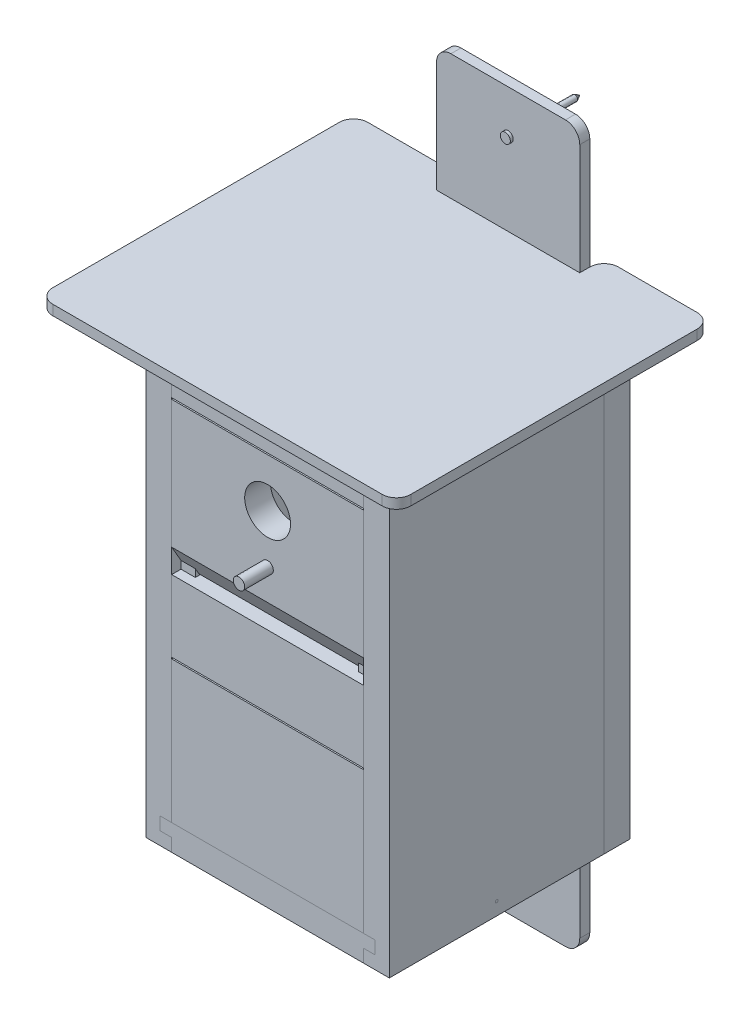
from build123d import *

# Parameters (mm, degrees)
SKIZZE1_W                             = 18
SKIZZE1_H                             = 300
AUFSATZ_LINEAR_AUSTRAGEN1_DEPTH       = 75
AUFSATZ_LINEAR_AUSTRAGEN1_2_DEPTH     = 75
SCHNITT_LINEAR_AUSTRAGEN1_DEPTH       = 321.702354216
SCHNITT_LINEAR_AUSTRAGEN1_DEPTH_BACK  = 321.702354216
SKIZZE2_W                             = 154
SKIZZE2_H                             = 5
SKIZZE3_W                             = 20
SKIZZE3_H                             = 5
AUFSATZ_LINEAR_AUSTRAGEN2_DEPTH       = 300
AUFSATZ_LINEAR_AUSTRAGEN2_2_DEPTH     = 300
AUFSATZ_LINEAR_AUSTRAGEN3_DEPTH       = 300
SKIZZE5_W                             = 170
SKIZZE5_H                             = 18
AUFSATZ_LINEAR_AUSTRAGEN4_DEPTH       = 300
SCHNITT_LINEAR_START                  = -150
SKIZZE6_W                             = 134
SKIZZE6_H                             = 18
SCHNITT_LINEAR_AUSTRAGEN2_DEPTH       = 150
SKIZZE7_W                             = 134
SKIZZE7_H                             = 18
AUFSATZ_LINEAR_AUSTRAGEN5_DEPTH       = 150
SKIZZE8_W                             = 8
SKIZZE8_H                             = 168
AUFSATZ_LINEAR_AUSTRAGEN6_DEPTH       = 8
AUFSATZ_LINEAR_AUSTRAGEN6_2_DEPTH     = 8
AUFSATZ_LINEAR_AUSTRAGEN6_3_DEPTH     = 8
AUFSATZ_LINEAR_AUSTRAGEN6_4_DEPTH     = 8
SKIZZE9_R                             = 1
SCHNITT_LINEAR_AUSTRAGEN3_DEPTH       = 8
SKIZZE10_W                            = 134
SKIZZE10_H                            = 168
AUFSATZ_LINEAR_AUSTRAGEN7_DEPTH       = 8
SKIZZE11_W                            = 170
SKIZZE11_H                            = 168
AUFSATZ_LINEAR_AUSTRAGEN8_DEPTH       = 10
SKIZZE12_W                            = 250
SKIZZE12_H                            = 220
AUFSATZ_LINEAR_AUSTRAGEN9_DEPTH       = 7
SKIZZE13_W                            = 100
SKIZZE13_H                            = 500
AUFSATZ_LINEAR_AUSTRAGEN10_DEPTH      = 7
SKIZZE14_W                            = 100
SKIZZE14_H                            = 500
SCHNITT_LINEAR_AUSTRAGEN4_DEPTH       = 379.14238249
VERRUNDUNG1_R                         = 10
VERRUNDUNG2_R                         = 10
SKIZZE15_R                            = 2
SKIZZE15_R_2                          = 1
SCHNITT_LINEAR_AUSTRAGEN5_DEPTH       = 379.14238249
SKIZZE16_W                            = 8
SKIZZE16_H                            = 9
SCHNITT_LINEAR_AUSTRAGEN6_DEPTH       = 150
SKIZZE18_W                            = 249.007887092
SKIZZE18_H                            = 36.15402976
SCHNITT_LINEAR_AUSTRAGEN7_DEPTH       = 7
SKIZZE19_W                            = 150
SKIZZE19_H                            = 9
AUFSATZ_LINEAR_AUSTRAGEN12_DEPTH      = 150
SKIZZE20_R                            = 16
SCHNITT_LINEAR_AUSTRAGEN8_DEPTH       = 28.5
SKIZZE21_W                            = 134
SKIZZE21_H                            = 1
SCHNITT_LINEAR_AUSTRAGEN10_DEPTH      = 28.5
SKIZZE22_R                            = 4
SCHNITT_LINEAR_AUSTRAGEN11_DEPTH      = 28.5
AUFSATZ_LINEAR_AUSTRAGEN13_DEPTH      = 20
AUFSATZ_LINEAR_AUSTRAGEN13_DEPTH_BACK = 38
SKIZZE23_R                            = 4
SCHNITT_LINEAR_AUSTRAGEN12_DEPTH      = 368.588984377
SCHNITT_LINEAR_AUSTRAGEN12_DEPTH_BACK = 368.588984377
SCHNITT_LINEAR_AUSTRAGEN13_DEPTH      = 378.303142626
SCHNITT_LINEAR_AUSTRAGEN13_DEPTH_BACK = 378.303142626
SKIZZE25_R                            = 1
SKIZZE26_R                            = 2
AUFSATZ_LINEAR_AUSTRAGEN14_DEPTH      = 50
SKIZZE27_R                            = 3.5
AUFSATZ_LINEAR_AUSTRAGEN15_DEPTH      = 2
FASE1_SIZE                            = 2
FASE1_SIZE2                           = 3.464101615
SKIZZE28_R                            = 1.25
AUFSATZ_LINEAR_AUSTRAGEN16_DEPTH      = 24
SKIZZE29_R                            = 3
AUFSATZ_LINEAR_AUSTRAGEN17_DEPTH      = 3
FASE2_SIZE                            = 2.383507185
FASE2_SIZE_2                          = 2
FASE3_SIZE                            = 1.1
FASE3_SIZE2                           = 1.905255888
K_RPER_VERSCHIEBEN_KOPIEREN4_ANGLE    = 90
K_RPER_VERSCHIEBEN_KOPIEREN8_ANGLE    = 88.5
K_RPER_VERSCHIEBEN_KOPIEREN10_ANGLE   = 1.5
K_RPER_VERSCHIEBEN_KOPIEREN13_ANGLE   = 120
K_RPER_VERSCHIEBEN_KOPIEREN13_2_ANGLE = 120
SPIEGELN5_ANGLE                       = 180
SPIEGELN5_2_ANGLE                     = 180
SPIEGELN5_3_ANGLE                     = 120
SPIEGELN5_4_ANGLE                     = 120
SPIEGELN5_5_ANGLE                     = 120
SPIEGELN5_6_ANGLE                     = 120
SPIEGELN5_7_ANGLE                     = 120
SPIEGELN5_8_ANGLE                     = 120
SPIEGELN5_9_ANGLE                     = 120
SPIEGELN5_10_ANGLE                    = 120
SKIZZE30_R                            = 1
SCHNITT_LINEAR_AUSTRAGEN14_DEPTH      = 18


with BuildPart() as part:
    # Skizze1 → Aufsatz-Linear austragen1 (new, symmetric)
    with BuildSketch(Plane.XY):
        with Locations((76, -56.026253401)):
            Rectangle(SKIZZE1_W, SKIZZE1_H)
    extrude(amount=AUFSATZ_LINEAR_AUSTRAGEN1_DEPTH, both=True)


with BuildPart() as body_2:
    # Skizze1 → Aufsatz-Linear austragen1 2 (new, symmetric)
    with BuildSketch(Plane.XY):
        with Locations((-76, -56.026253401)):
            Rectangle(SKIZZE1_W, SKIZZE1_H)
    extrude(amount=AUFSATZ_LINEAR_AUSTRAGEN1_2_DEPTH, both=True)


with BuildPart() as schnitt_linear_austragen1_tool:
    # Skizze2 → Schnitt-Linear austragen1 (new, two sides: drawn at the far end of the back side and taken through both)
    with BuildSketch(Plane(origin=(0, 93.973746599, 0), x_dir=(1, 0, 0), z_dir=(0, 1, 0)).offset(-SCHNITT_LINEAR_AUSTRAGEN1_DEPTH_BACK)):
        with Locations((0, -66)):
            Rectangle(SKIZZE2_W, SKIZZE2_H)
    extrude(amount=SCHNITT_LINEAR_AUSTRAGEN1_DEPTH + SCHNITT_LINEAR_AUSTRAGEN1_DEPTH_BACK)


with BuildPart() as part_1:
    add(part.part)

    # Schnitt-Linear austragen1: cut by schnitt_linear_austragen1_tool
    add(schnitt_linear_austragen1_tool.part, mode=Mode.SUBTRACT)


with BuildPart() as body_2_1:
    add(body_2.part)

    # Schnitt-Linear austragen1: cut by schnitt_linear_austragen1_tool
    add(schnitt_linear_austragen1_tool.part, mode=Mode.SUBTRACT)


with BuildPart() as body_3:
    # Skizze3 → Aufsatz-Linear austragen2 (new body)
    with BuildSketch(Plane(origin=(0, 93.973746599, 0), x_dir=(1, 0, 0), z_dir=(0, 1, 0))):
        with Locations((-67, -66)):
            Rectangle(SKIZZE3_W, SKIZZE3_H)
    extrude(amount=-AUFSATZ_LINEAR_AUSTRAGEN2_DEPTH)


with BuildPart() as body_4:
    # Skizze3 → Aufsatz-Linear austragen2 2 (new body)
    with BuildSketch(Plane(origin=(0, 93.973746599, 0), x_dir=(1, 0, 0), z_dir=(0, 1, 0))):
        with Locations((67, -66)):
            Rectangle(SKIZZE3_W, SKIZZE3_H)
    extrude(amount=-AUFSATZ_LINEAR_AUSTRAGEN2_2_DEPTH)


with BuildPart() as body_5:
    # Skizze4 → Aufsatz-Linear austragen3 (new body)
    with BuildSketch(Plane(origin=(0, 93.973746599, 0), x_dir=(1, 0, 0), z_dir=(0, 1, 0))):
        Polygon((-67, -75), (67, -75), (67, -68.5), (57, -68.5), (57, -63.5), (67, -63.5), (67, -57), (-67, -57), (-67, -63.5), (-57, -63.5), (-57, -68.5), (-67, -68.5), align=None)
    extrude(amount=-AUFSATZ_LINEAR_AUSTRAGEN3_DEPTH)


with BuildPart() as body_6:
    # Skizze5 → Aufsatz-Linear austragen4 (new body)
    with BuildSketch(Plane(origin=(0, 93.973746599, 0), x_dir=(1, 0, 0), z_dir=(0, 1, 0))):
        with Locations((0, 84)):
            Rectangle(SKIZZE5_W, SKIZZE5_H)
    extrude(amount=-AUFSATZ_LINEAR_AUSTRAGEN4_DEPTH)

    # Skizze30 → Schnitt-Linear austragen14 (cut)
    with BuildSketch(Plane(origin=(0, 0, -93), x_dir=(-1, 0, 0), z_dir=(0, 0, -1))):
        with Locations((-76, 73.973746599)):
            Circle(SKIZZE30_R)
        with Locations(Location((76, 73.973746599, 0), (0, 0, 180))):
            Circle(SKIZZE30_R)
        with Locations((0, -197.026253401)):
            Circle(SKIZZE30_R)
    extrude(amount=-SCHNITT_LINEAR_AUSTRAGEN14_DEPTH, mode=Mode.SUBTRACT)


with BuildPart() as schnitt_linear_austragen2_tool:
    # Skizze6 → Schnitt-Linear austragen2 (new body)
    with BuildSketch(Plane.XY.offset(75).offset(SCHNITT_LINEAR_START)):
        with Locations((0, -197.026253401)):
            Rectangle(SKIZZE6_W, SKIZZE6_H)
    extrude(amount=SCHNITT_LINEAR_AUSTRAGEN2_DEPTH)


with BuildPart() as body_3_1:
    add(body_3.part)

    # Schnitt-Linear austragen2: cut by schnitt_linear_austragen2_tool
    add(schnitt_linear_austragen2_tool.part, mode=Mode.SUBTRACT)


with BuildPart() as body_4_1:
    add(body_4.part)

    # Schnitt-Linear austragen2: cut by schnitt_linear_austragen2_tool
    add(schnitt_linear_austragen2_tool.part, mode=Mode.SUBTRACT)


with BuildPart() as body_5_1:
    add(body_5.part)

    # Schnitt-Linear austragen2: cut by schnitt_linear_austragen2_tool
    add(schnitt_linear_austragen2_tool.part, mode=Mode.SUBTRACT)

    # Skizze20 → Schnitt-Linear austragen8 (cut, symmetric)
    with BuildSketch(Plane.XY.offset(75)):
        with Locations((0, 33.973746599)):
            Circle(SKIZZE20_R)
    extrude(amount=SCHNITT_LINEAR_AUSTRAGEN8_DEPTH, both=True, mode=Mode.SUBTRACT)

    # Skizze21 → Schnitt-Linear austragen10 (cut, symmetric)
    with BuildSketch(Plane.XY.offset(75)):
        with Locations((0, 68.473746599)):
            Rectangle(SKIZZE21_W, SKIZZE21_H)
        with Locations((0, -37.526253401)):
            Rectangle(SKIZZE21_W, SKIZZE21_H)
        with Locations((0, -88.526253401)):
            Rectangle(SKIZZE21_W, SKIZZE21_H)
    extrude(amount=SCHNITT_LINEAR_AUSTRAGEN10_DEPTH, both=True, mode=Mode.SUBTRACT)


with BuildPart() as body_7:
    # Skizze7 → Aufsatz-Linear austragen5 (new body)
    with BuildSketch(Plane.XY.offset(-75)):
        with Locations((0, -197.026253401)):
            Rectangle(SKIZZE7_W, SKIZZE7_H)
    extrude(amount=AUFSATZ_LINEAR_AUSTRAGEN5_DEPTH)


with BuildPart() as body_8:
    # Skizze8 → Aufsatz-Linear austragen6 (new body)
    with BuildSketch(Plane(origin=(0, 93.973746599, 0), x_dir=(1, 0, 0), z_dir=(0, 1, 0))):
        with Locations((-81, 9)):
            Rectangle(SKIZZE8_W, SKIZZE8_H)
    extrude(amount=AUFSATZ_LINEAR_AUSTRAGEN6_DEPTH)


with BuildPart() as body_9:
    # Skizze8 → Aufsatz-Linear austragen6 2 (new body)
    with BuildSketch(Plane(origin=(0, 93.973746599, 0), x_dir=(1, 0, 0), z_dir=(0, 1, 0))):
        with Locations((-71, 9)):
            Rectangle(SKIZZE8_W, SKIZZE8_H)
    extrude(amount=AUFSATZ_LINEAR_AUSTRAGEN6_2_DEPTH)


with BuildPart() as body_10:
    # Skizze8 → Aufsatz-Linear austragen6 3 (new body)
    with BuildSketch(Plane(origin=(0, 93.973746599, 0), x_dir=(1, 0, 0), z_dir=(0, 1, 0))):
        with Locations((71, 9)):
            Rectangle(SKIZZE8_W, SKIZZE8_H)
    extrude(amount=AUFSATZ_LINEAR_AUSTRAGEN6_3_DEPTH)


with BuildPart() as body_11:
    # Skizze8 → Aufsatz-Linear austragen6 4 (new body)
    with BuildSketch(Plane(origin=(0, 93.973746599, 0), x_dir=(1, 0, 0), z_dir=(0, 1, 0))):
        with Locations((81, 9)):
            Rectangle(SKIZZE8_W, SKIZZE8_H)
    extrude(amount=AUFSATZ_LINEAR_AUSTRAGEN6_4_DEPTH)


with BuildPart() as schnitt_linear_austragen3_tool:
    # Skizze9 → Schnitt-Linear austragen3 (new body)
    with BuildSketch(Plane(origin=(0, 101.973746599, 0), x_dir=(1, 0, 0), z_dir=(0, 1, 0))):
        with Locations(Location((-81, 63, 0), (0, 0, 270))):
            Circle(SKIZZE9_R)
        with Locations(Location((-71, 63, 0), (0, 0, 270))):
            Circle(SKIZZE9_R)
        with Locations(Location((-71, -45, 0), (0, 0, 270))):
            Circle(SKIZZE9_R)
        with Locations(Location((-81, -45, 0), (0, 0, 270))):
            Circle(SKIZZE9_R)
        with Locations(Location((81, -45, 0), (0, 0, 90))):
            Circle(SKIZZE9_R)
        with Locations(Location((71, -45, 0), (0, 0, 90))):
            Circle(SKIZZE9_R)
        with Locations(Location((71, 63, 0), (0, 0, 90))):
            Circle(SKIZZE9_R)
        with Locations(Location((81, 63, 0), (0, 0, 90))):
            Circle(SKIZZE9_R)
    extrude(amount=-SCHNITT_LINEAR_AUSTRAGEN3_DEPTH)


with BuildPart() as body_8_1:
    add(body_8.part)

    # Schnitt-Linear austragen3: cut by schnitt_linear_austragen3_tool
    add(schnitt_linear_austragen3_tool.part, mode=Mode.SUBTRACT)


with BuildPart() as body_9_1:
    add(body_9.part)

    # Schnitt-Linear austragen3: cut by schnitt_linear_austragen3_tool
    add(schnitt_linear_austragen3_tool.part, mode=Mode.SUBTRACT)


with BuildPart() as body_10_1:
    add(body_10.part)

    # Schnitt-Linear austragen3: cut by schnitt_linear_austragen3_tool
    add(schnitt_linear_austragen3_tool.part, mode=Mode.SUBTRACT)


with BuildPart() as body_11_1:
    add(body_11.part)

    # Schnitt-Linear austragen3: cut by schnitt_linear_austragen3_tool
    add(schnitt_linear_austragen3_tool.part, mode=Mode.SUBTRACT)


with BuildPart() as body_12:
    # Skizze10 → Aufsatz-Linear austragen7 (new body)
    with BuildSketch(Plane(origin=(0, 93.973746599, 0), x_dir=(1, 0, 0), z_dir=(0, 1, 0))):
        with Locations((0, 9)):
            Rectangle(SKIZZE10_W, SKIZZE10_H)
    extrude(amount=AUFSATZ_LINEAR_AUSTRAGEN7_DEPTH)


with BuildPart() as body_13:
    # Skizze11 → Aufsatz-Linear austragen8 (new body)
    with BuildSketch(Plane(origin=(0, 101.973746599, 0), x_dir=(1, 0, 0), z_dir=(0, 1, 0))):
        with Locations((0, 9)):
            Rectangle(SKIZZE11_W, SKIZZE11_H)
    extrude(amount=AUFSATZ_LINEAR_AUSTRAGEN8_DEPTH)

    # Kombinieren1: union body 12
    add(body_12.part)


with BuildPart() as body_13_2:
    # Skizze12 → Aufsatz-Linear austragen9 (new body)
    with BuildSketch(Plane(origin=(0, 111.973746599, 0), x_dir=(1, 0, 0), z_dir=(0, 1, 0))):
        Rectangle(SKIZZE12_W, SKIZZE12_H)
    extrude(amount=AUFSATZ_LINEAR_AUSTRAGEN9_DEPTH)

    # Skizze14 → Schnitt-Linear austragen4 (cut, through all)
    with BuildSketch(Plane(origin=(0, 0, -93), x_dir=(-1, 0, 0), z_dir=(0, 0, -1))):
        with Locations((0, -43.526253401)):
            Rectangle(SKIZZE14_W, SKIZZE14_H)
    extrude(amount=SCHNITT_LINEAR_AUSTRAGEN4_DEPTH, mode=Mode.SUBTRACT)

    # Verrundung1
    verrundung1_edges = [body_13_2.edges().sort_by_distance(p)[0] for p in [
        (50, 115.473746599, -110),
        (-50, 115.473746599, -110),
        (-125, 115.473746599, -110),
        (125, 115.473746599, -110),
        (125, 115.473746599, 110),
        (-125, 115.473746599, 110),
    ]]
    fillet(verrundung1_edges, radius=VERRUNDUNG1_R)


with BuildPart() as body_14:
    # Skizze13 → Aufsatz-Linear austragen10 (new body)
    with BuildSketch(Plane(origin=(0, 0, -93), x_dir=(-1, 0, 0), z_dir=(0, 0, -1))):
        with Locations((0, -43.526253401)):
            Rectangle(SKIZZE13_W, SKIZZE13_H)
    extrude(amount=AUFSATZ_LINEAR_AUSTRAGEN10_DEPTH)

    # Verrundung2
    verrundung2_edges = [body_14.edges().sort_by_distance(p)[0] for p in [
        (50, -293.526253401, -96.5),
        (50, 206.473746599, -96.5),
        (-50, 206.473746599, -96.5),
        (-50, -293.526253401, -96.5),
    ]]
    fillet(verrundung2_edges, radius=VERRUNDUNG2_R)

    # Skizze15 → Schnitt-Linear austragen5 (cut, through all)
    with BuildSketch(Plane.XY.offset(-93)):
        with Locations((0, -263.526253401)):
            Circle(SKIZZE15_R)
        with Locations(Location((0, 176.473746599, 0), (0, 0, 180))):
            Circle(SKIZZE15_R)
        with Locations((0, 46.473746599)):
            Circle(SKIZZE15_R_2)
        with Locations((0, -163.526253401)):
            Circle(SKIZZE15_R_2)
    extrude(amount=-SCHNITT_LINEAR_AUSTRAGEN5_DEPTH, mode=Mode.SUBTRACT)


with BuildPart() as schnitt_linear_austragen6_tool:
    # Skizze16 → Schnitt-Linear austragen6 (new body)
    with BuildSketch(Plane.XY.offset(75).offset(SCHNITT_LINEAR_START)):
        with Locations((-71, -192.526253401)):
            Rectangle(SKIZZE16_W, SKIZZE16_H)
        with Locations((71, -192.526253401)):
            Rectangle(SKIZZE16_W, SKIZZE16_H)
    extrude(amount=SCHNITT_LINEAR_AUSTRAGEN6_DEPTH)


with BuildPart() as part_2:
    add(part_1.part)

    # Schnitt-Linear austragen6: cut by schnitt_linear_austragen6_tool
    add(schnitt_linear_austragen6_tool.part, mode=Mode.SUBTRACT)


with BuildPart() as body_2_2:
    add(body_2_1.part)

    # Schnitt-Linear austragen6: cut by schnitt_linear_austragen6_tool
    add(schnitt_linear_austragen6_tool.part, mode=Mode.SUBTRACT)


with BuildPart() as body_3_2:
    add(body_3_1.part)

    # Schnitt-Linear austragen6: cut by schnitt_linear_austragen6_tool
    add(schnitt_linear_austragen6_tool.part, mode=Mode.SUBTRACT)


with BuildPart() as body_4_2:
    add(body_4_1.part)

    # Schnitt-Linear austragen6: cut by schnitt_linear_austragen6_tool
    add(schnitt_linear_austragen6_tool.part, mode=Mode.SUBTRACT)


with BuildPart() as schnitt_linear_austragen7_tool:
    # Skizze18 → Schnitt-Linear austragen7 (new body)
    with BuildSketch(Plane.XY.offset(68.5)):
        with Locations((19.733394445, -206.103268281)):
            Rectangle(SKIZZE18_W, SKIZZE18_H)
    extrude(amount=-SCHNITT_LINEAR_AUSTRAGEN7_DEPTH)


with BuildPart() as body_4_3:
    add(body_4_2.part)

    # Schnitt-Linear austragen7: cut by schnitt_linear_austragen7_tool
    add(schnitt_linear_austragen7_tool.part, mode=Mode.SUBTRACT)


with BuildPart() as body_3_3:
    add(body_3_2.part)

    # Schnitt-Linear austragen7: cut by schnitt_linear_austragen7_tool
    add(schnitt_linear_austragen7_tool.part, mode=Mode.SUBTRACT)


with BuildPart() as body_15:
    # Skizze19 → Aufsatz-Linear austragen12 (new body)
    with BuildSketch(Plane.XY.offset(75)):
        with Locations((0, -192.526253401)):
            Rectangle(SKIZZE19_W, SKIZZE19_H)
    extrude(amount=-AUFSATZ_LINEAR_AUSTRAGEN12_DEPTH)

    # Kombinieren3: union body 7
    add(body_7.part)


with BuildPart() as schnitt_linear_austragen10_piece_1:
    # of the separate pieces the step leaves, piece 1, a body of its own (schnitt_linear_austragen10_pieces)
    add(body_5_1.part.solids().sort_by_distance((67, -89.026253401, 75))[0])


with BuildPart() as schnitt_linear_austragen10_piece_2:
    # of the separate pieces the step leaves, piece 2, a body of its own (schnitt_linear_austragen10_pieces)
    add(body_5_1.part.solids().sort_by_distance((67, 67.973746599, 75))[0])

    # Skizze22 → Schnitt-Linear austragen11 (cut, symmetric)
    with BuildSketch(Plane.XY.offset(75)):
        Circle(SKIZZE22_R)
    extrude(amount=SCHNITT_LINEAR_AUSTRAGEN11_DEPTH, both=True, mode=Mode.SUBTRACT)

    # Skizze24 → Schnitt-Linear austragen12 (cut, two sides: drawn at the far end of the back side and taken through both)
    with BuildSketch(Plane(origin=(67, 0, 0), x_dir=(0, 0, -1), z_dir=(1, 0, 0)).offset(-SCHNITT_LINEAR_AUSTRAGEN12_DEPTH_BACK)):
        Polygon((-66, -37.026253401), (-82.685253354, -8.126546855), (-92.429289283, -39.969111207), (-75, -37.026253401), align=None)
    extrude(amount=SCHNITT_LINEAR_AUSTRAGEN12_DEPTH + SCHNITT_LINEAR_AUSTRAGEN12_DEPTH_BACK, mode=Mode.SUBTRACT)


with BuildPart() as schnitt_linear_austragen10_piece_3:
    # of the separate pieces the step leaves, piece 3, a body of its own (schnitt_linear_austragen10_pieces)
    add(body_5_1.part.solids().sort_by_distance((67, -38.026253401, 75))[0])


with BuildPart() as schnitt_linear_austragen10_piece_4:
    # of the separate pieces the step leaves, piece 4, a body of its own (schnitt_linear_austragen10_pieces)
    add(body_5_1.part.solids().sort_by_distance((-67, 93.973746599, 75))[0])


with BuildPart() as body_18:
    # Skizze23 → Aufsatz-Linear austragen13 (new, two sides: drawn at the far end of the back side and taken through both)
    with BuildSketch(Plane.XY.offset(75).offset(-AUFSATZ_LINEAR_AUSTRAGEN13_DEPTH_BACK)):
        Circle(SKIZZE23_R)
    extrude(amount=AUFSATZ_LINEAR_AUSTRAGEN13_DEPTH + AUFSATZ_LINEAR_AUSTRAGEN13_DEPTH_BACK)


with BuildPart() as schnitt_linear_austragen13_tool:
    # Skizze25 → Schnitt-Linear austragen13 (new, two sides: drawn at the far end of the back side and taken through both)
    with BuildSketch(Plane(origin=(85, 0, 0), x_dir=(0, 0, -1), z_dir=(1, 0, 0)).offset(-SCHNITT_LINEAR_AUSTRAGEN13_DEPTH_BACK)):
        with Locations(Location((0, -197.026253401, 0), (0, 0, 90))):
            Circle(SKIZZE25_R)
    extrude(amount=SCHNITT_LINEAR_AUSTRAGEN13_DEPTH + SCHNITT_LINEAR_AUSTRAGEN13_DEPTH_BACK)


with BuildPart() as part_3:
    add(part_2.part)

    # Schnitt-Linear austragen13: cut by schnitt_linear_austragen13_tool
    add(schnitt_linear_austragen13_tool.part, mode=Mode.SUBTRACT)


with BuildPart() as body_2_3:
    add(body_2_2.part)

    # Schnitt-Linear austragen13: cut by schnitt_linear_austragen13_tool
    add(schnitt_linear_austragen13_tool.part, mode=Mode.SUBTRACT)


with BuildPart() as body_19:
    # Skizze26 → Aufsatz-Linear austragen14 (new body)
    with BuildSketch(Plane.XY.offset(-93)):
        with Locations((0, 176.473746599)):
            Circle(SKIZZE26_R)
    extrude(amount=-AUFSATZ_LINEAR_AUSTRAGEN14_DEPTH)

    # Skizze27 → Aufsatz-Linear austragen15 (add)
    with BuildSketch(Plane.XY.offset(-93)):
        with Locations((0, 176.473746599)):
            Circle(SKIZZE27_R)
    extrude(amount=AUFSATZ_LINEAR_AUSTRAGEN15_DEPTH)

    # Fase1
    fase1_edges = [body_19.edges().sort_by_distance(p)[0] for p in [
        (-2, 176.473746599, -143),
    ]]
    fase1_side = [body_19.faces().sort_by_distance(p)[0] for p in [
        (0, 176.473746599, -143),
    ]]
    chamfer(fase1_edges, length=FASE1_SIZE, length2=FASE1_SIZE2, reference=fase1_side[0])


with BuildPart() as body_20:
    # Spiegeln1: mirrored copy
    add(body_19.part.mirror(Plane.ZX))


with BuildPart() as body_20_1:
    # Körper-Verschieben/Kopieren1: moved
    add(body_20.part.moved(Location((0, -87.110705861, 0))))


with BuildPart() as body_21:
    # Skizze28 → Aufsatz-Linear austragen16 (new body)
    with BuildSketch(Plane(origin=(0, 0, -100), x_dir=(-1, 0, 0), z_dir=(0, 0, -1))):
        with Locations((0, 46.473746599)):
            Circle(SKIZZE28_R)
    extrude(amount=-AUFSATZ_LINEAR_AUSTRAGEN16_DEPTH)

    # Skizze29 → Aufsatz-Linear austragen17 (add)
    with BuildSketch(Plane(origin=(0, 0, -100), x_dir=(-1, 0, 0), z_dir=(0, 0, -1))):
        with Locations((0, 46.473746599)):
            Circle(SKIZZE29_R)
    extrude(amount=-AUFSATZ_LINEAR_AUSTRAGEN17_DEPTH)

    # Fase2
    # the kernel refuses this chamfer: 2.383507185, 2 mm, written as the material it takes off along each edge
    with BuildSketch(Plane(origin=(0, 46.473746599, -97), x_dir=(-1, 0, 0), z_dir=(0, -1, 0))) as fase2_piece_1_section:
        Polygon((3, FASE2_SIZE), (3 - FASE2_SIZE_2, 0), (3, 0), align=None)
    fase2_piece_1 = revolve(axis=Axis((0, 46.473746599, -97), (0, 0, -1)), mode=Mode.PRIVATE)
    fase2_piece_1 = fase2_piece_1 - Plane(origin=(0, 46.473746599, -97), x_dir=(-1, 0, 0), z_dir=(0, 0, -1)) * Cylinder(1.25, 13, mode=Mode.PRIVATE)
    add(fase2_piece_1, mode=Mode.SUBTRACT)

    # Fase3
    fase3_edges = [body_21.edges().sort_by_distance(p)[0] for p in [
        (1.25, 46.473746599, -76),
    ]]
    fase3_side = [body_21.faces().sort_by_distance(p)[0] for p in [
        (0, 46.473746599, -76),
    ]]
    chamfer(fase3_edges, length=FASE3_SIZE, length2=FASE3_SIZE2, reference=fase3_side[0])


with BuildPart() as body_22:
    # Körper-Verschieben/Kopieren2: copy of body 21
    add(body_21.part.moved(Location((0, -209.997627393, 0))))


with BuildPart() as body_23:
    # Körper-Verschieben/Kopieren3: copy of body 22
    add(body_22.part.moved(Location((191.871245138, 0, 0))))


with BuildPart() as body_23_1:
    # Körper-Verschieben/Kopieren4: moved
    add(body_23.part.rotate(Axis((191.871245138, 0, -88), (0, -1, 0)), K_RPER_VERSCHIEBEN_KOPIEREN4_ANGLE))


with BuildPart() as body_23_2:
    # Körper-Verschieben/Kopieren5: moved
    add(body_23_1.part.moved(Location((-109.731802929, -33.551091003, 87.977482306))))


with BuildPart() as body_23_3:
    # Körper-Verschieben/Kopieren6: moved
    add(body_23_2.part.moved(Location((-9.14, 0, 0))))


with BuildPart() as body_24:
    # Spiegeln2: mirrored copy
    add(body_23_3.part.mirror(Plane(origin=(0, 0, 0), x_dir=(0, 0, 1), z_dir=(1, 0, 0))))


with BuildPart() as body_25:
    # Körper-Verschieben/Kopieren7: copy of body 21
    add(body_21.part.moved(Location((0, 0, 110.641015517))))


with BuildPart() as body_25_1:
    # Körper-Verschieben/Kopieren8: moved
    add(body_25.part.rotate(Axis((0, 46.473746599, 22.641015517), (1, 0, 0)), K_RPER_VERSCHIEBEN_KOPIEREN8_ANGLE))


with BuildPart() as body_25_2:
    # Körper-Verschieben/Kopieren9: moved
    add(body_25_1.part.moved(Location((-81.015270113, 77.527659909, 22.633995996))))


with BuildPart() as body_25_3:
    # Körper-Verschieben/Kopieren10: moved
    add(body_25_2.part.rotate(Axis((0, 124.03870866, 44.968957084), (1, 0, 0)), K_RPER_VERSCHIEBEN_KOPIEREN10_ANGLE))


with BuildPart() as body_25_4:
    # Körper-Verschieben/Kopieren11: moved
    add(body_25_3.part.moved(Location((0, 0, -0.136742919))))


with BuildPart() as body_26:
    # Körper-Verschieben/Kopieren12: copy of body 25
    add(body_25_4.part.moved(Location((0, 0, -108.14176765))))


with BuildPart() as body_27:
    # Körper-Verschieben/Kopieren13: read off the stored shape, not the designer's step
    # Körper-Verschieben/Kopieren13: copy of body 24
    add(body_24.part.moved(Location((-50.9939655, 260.0795522, -70.996975))).rotate(Axis((0, 0, 0), (-0.5773502692, 0.5773502692, -0.5773502692)), K_RPER_VERSCHIEBEN_KOPIEREN13_ANGLE))


with BuildPart() as body_28:
    # K_rper-Verschieben_Kopieren13 2: copy of body 24
    add(body_24.part.moved(Location((-50.9939655, 151.9377845, -70.996975))).rotate(Axis((0, 0, 0), (-0.5773502692, 0.5773502692, -0.5773502692)), K_RPER_VERSCHIEBEN_KOPIEREN13_2_ANGLE))


with BuildPart() as body_29:
    # Spiegeln3: mirrored copy
    add(body_25_4.part.mirror(Plane(origin=(0, 0, 0), x_dir=(0, 0, 1), z_dir=(1, 0, 0))))


with BuildPart() as body_30:
    # Spiegeln3 2: mirrored copy
    add(body_26.part.mirror(Plane(origin=(0, 0, 0), x_dir=(0, 0, 1), z_dir=(1, 0, 0))))


with BuildPart() as body_31:
    # Spiegeln4: mirrored copy
    add(body_28.part.mirror(Plane(origin=(0, 0, 0), x_dir=(0, 0, 1), z_dir=(1, 0, 0))))


with BuildPart() as body_32:
    # Spiegeln4 2: mirrored copy
    add(body_27.part.mirror(Plane(origin=(0, 0, 0), x_dir=(0, 0, 1), z_dir=(1, 0, 0))))


with BuildPart() as body_33:
    # Spiegeln5: read off the stored shape, not the designer's step
    # Spiegeln5: copy of body 24
    add(body_24.part.moved(Location((0, -271.9868154, 0))).rotate(Axis((0, 0, 0), (0, 0, 1)), SPIEGELN5_ANGLE))


with BuildPart() as body_34:
    # Spiegeln5 2: copy of body 24
    add(body_24.part.moved(Location((0, -271.9868154, 0))).rotate(Axis((0, 0, 0), (0, 0, 1)), SPIEGELN5_2_ANGLE))


with BuildPart() as body_35:
    # Spiegeln5 3: copy of body 24
    add(body_24.part.moved(Location((220.9928499, 260.0795522, -70.996975))).rotate(Axis((0, 0, 0), (-0.5773502692, -0.5773502692, 0.5773502692)), SPIEGELN5_3_ANGLE))


with BuildPart() as body_36:
    # Spiegeln5 4: copy of body 24
    add(body_24.part.moved(Location((220.9928499, 151.9377845, -70.996975))).rotate(Axis((0, 0, 0), (-0.5773502692, -0.5773502692, 0.5773502692)), SPIEGELN5_4_ANGLE))


with BuildPart() as body_37:
    # Spiegeln5 5: copy of body 24
    add(body_24.part.moved(Location((220.9928499, 134.0703914, -70.996975))).rotate(Axis((0, 0, 0), (0.5773502692, 0.5773502692, 0.5773502692)), SPIEGELN5_5_ANGLE))


with BuildPart() as body_38:
    # Spiegeln5 6: copy of body 24
    add(body_24.part.moved(Location((220.9928499, 242.2121591, -70.996975))).rotate(Axis((0, 0, 0), (0.5773502692, 0.5773502692, 0.5773502692)), SPIEGELN5_6_ANGLE))


with BuildPart() as body_39:
    # Spiegeln5 7: copy of body 24
    add(body_24.part.moved(Location((220.9928499, 134.0703914, -70.996975))).rotate(Axis((0, 0, 0), (0.5773502692, 0.5773502692, 0.5773502692)), SPIEGELN5_7_ANGLE))


with BuildPart() as body_40:
    # Spiegeln5 8: copy of body 24
    add(body_24.part.moved(Location((220.9928499, 242.2121591, -70.996975))).rotate(Axis((0, 0, 0), (0.5773502692, 0.5773502692, 0.5773502692)), SPIEGELN5_8_ANGLE))


with BuildPart() as body_41:
    # Spiegeln5 9: copy of body 24
    add(body_24.part.moved(Location((220.9928499, 260.0795522, -70.996975))).rotate(Axis((0, 0, 0), (-0.5773502692, -0.5773502692, 0.5773502692)), SPIEGELN5_9_ANGLE))


with BuildPart() as body_42:
    # Spiegeln5 10: copy of body 24
    add(body_24.part.moved(Location((220.9928499, 151.9377845, -70.996975))).rotate(Axis((0, 0, 0), (-0.5773502692, -0.5773502692, 0.5773502692)), SPIEGELN5_10_ANGLE))


with BuildPart() as body_39_1:
    # Körper-Verschieben/Kopieren14: moved
    add(body_39.part.moved(Location((-4.1e-08, -42.019999971, 8e-09))))


with BuildPart() as body_40_1:
    # Körper-Verschieben/Kopieren14: moved
    add(body_40.part.moved(Location((-4.1e-08, -42.019999971, 8e-09))))


with BuildPart() as body_41_1:
    # Körper-Verschieben/Kopieren14: moved
    add(body_41.part.moved(Location((-4.1e-08, -42.019999971, 8e-09))))


with BuildPart() as body_42_1:
    # Körper-Verschieben/Kopieren14: moved
    add(body_42.part.moved(Location((-4.1e-08, -42.019999971, 8e-09))))


with BuildPart() as body_25_5:
    # Körper-Verschieben/Kopieren15: moved
    add(body_25_4.part.moved(Location((0, -34.02, 0))))


with BuildPart() as body_26_1:
    # Körper-Verschieben/Kopieren15: moved
    add(body_26.part.moved(Location((0, -34.02, 0))))


with BuildPart() as body_30_1:
    # Körper-Verschieben/Kopieren15: moved
    add(body_30.part.moved(Location((0, -34.02, 0))))


with BuildPart() as body_29_1:
    # Körper-Verschieben/Kopieren15: moved
    add(body_29.part.moved(Location((0, -34.02, 0))))


with BuildPart() as body_21_1:
    # Körper-Verschieben/Kopieren43: moved
    add(body_21.part.moved(Location((0, 0, -150))))


with BuildPart() as body_22_1:
    # Körper-Verschieben/Kopieren43: moved
    add(body_22.part.moved(Location((0, 0, -150))))


with BuildPart() as body_21_2:
    # Körper-Verschieben/Kopieren44: moved
    add(body_21_1.part.moved(Location((0, 0, 148.840934076))))


with BuildPart() as body_22_2:
    # Körper-Verschieben/Kopieren44: moved
    add(body_22_1.part.moved(Location((0, 0, 148.840934076))))


solid = Compound([body_6.part, body_8_1.part, body_9_1.part, body_10_1.part, body_11_1.part, body_13.part, body_13_2.part, body_14.part, body_4_3.part, body_3_3.part, body_15.part, schnitt_linear_austragen10_piece_1.part, schnitt_linear_austragen10_piece_2.part, schnitt_linear_austragen10_piece_3.part, schnitt_linear_austragen10_piece_4.part, body_18.part, part_3.part, body_2_3.part, body_19.part, body_20_1.part, body_23_3.part, body_24.part, body_39_1.part, body_40_1.part, body_41_1.part, body_42_1.part, body_25_5.part, body_26_1.part, body_30_1.part, body_29_1.part, body_21_2.part, body_22_2.part])
